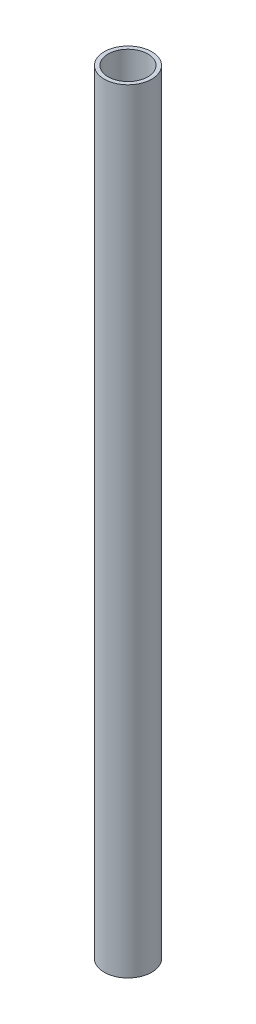
from build123d import *

# Parameters (mm, degrees)
CROQUIS2_R                 = 8.14
SALIENTE_EXTRUIR3_DEPTH    = 132.5
CORTAR_EXTRUIR1_DEPTH      = 459
CORTAR_EXTRUIR1_DEPTH_BACK = 300
CROQUIS5_R                 = 6.8


with BuildPart() as part:
    # Croquis2 → Saliente-Extruir3 (new, symmetric)
    with BuildSketch(Plane(origin=(0, 0, 0), x_dir=(1, 0, 0), z_dir=(0, 1, 0))):
        Circle(CROQUIS2_R)
    extrude(amount=SALIENTE_EXTRUIR3_DEPTH, both=True)

    # Croquis5 → Cortar-Extruir1 (cut, two sides: drawn at the far end of the back side and taken through both)
    with BuildSketch(Plane(origin=(0, 0, 0), x_dir=(1, 0, 0), z_dir=(0, 1, 0)).offset(-CORTAR_EXTRUIR1_DEPTH_BACK)):
        Circle(CROQUIS5_R)
    extrude(amount=CORTAR_EXTRUIR1_DEPTH + CORTAR_EXTRUIR1_DEPTH_BACK, mode=Mode.SUBTRACT)


solid = part.part
